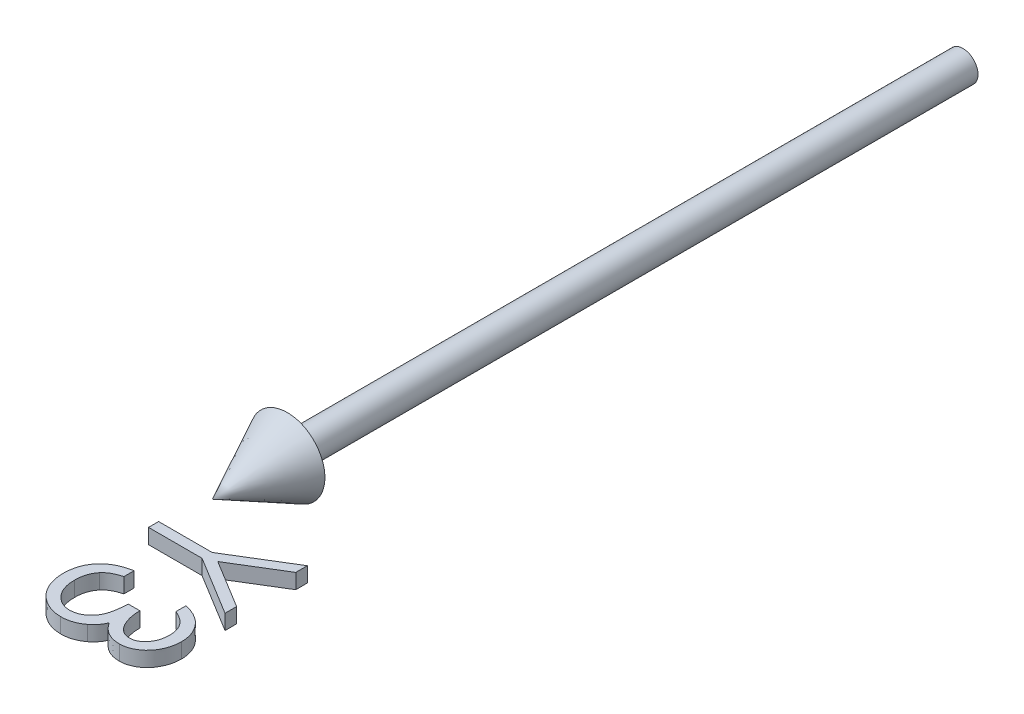
from build123d import *

# Parameters (mm, degrees)
BOSS_EXTRUDE1_DEPTH        = 1
BOSS_EXTRUDE1_DEPTH_BACK   = 1
BOSS_EXTRUDE1_2_DEPTH      = 1
BOSS_EXTRUDE1_2_DEPTH_BACK = 1


with BuildPart() as part:
    # Sketch2 → Revolve1 (revolve)
    with BuildSketch(Plane(origin=(0, 0, 0), x_dir=(1, 0, 0), z_dir=(0, 1, 0))):
        Polygon((0, -100), (5, -90), (2, -90), (2, 0), (0, 0), align=None)
    revolve(axis=Axis((0, 0, -41.949952025), (0, 0, 1)))


with BuildPart() as body_2:
    # Sketch3 → Boss-Extrude1 (new, two sides: drawn at the far end of the back side and taken through both)
    with BuildSketch(Plane(origin=(0, 0, 0), x_dir=(1, 0, 0), z_dir=(0, 1, 0)).offset(-BOSS_EXTRUDE1_DEPTH_BACK)):
        Polygon((15, -102.339799406), (15, -103.881265752), (8.5546875, -107.823573444), (15, -111.759871521), (15, -113.301337867), (7.130408654, -108.49364556), (0, -108.49364556), (0, -107.147491713), (7.130408654, -107.147491713), align=None)
    extrude(amount=BOSS_EXTRUDE1_DEPTH + BOSS_EXTRUDE1_DEPTH_BACK)


with BuildPart() as body_3:
    # Sketch3 → Boss-Extrude1 2 (new, two sides: drawn at the far end of the back side and taken through both)
    with BuildSketch(Plane(origin=(0, 0, 0), x_dir=(1, 0, 0), z_dir=(0, 1, 0)).offset(-BOSS_EXTRUDE1_2_DEPTH_BACK)):
        with BuildLine():
            Line((11.538461538, -116.378260944), (11.538461538, -115.032107098))
            add(Edge.make_bspline(
                [(11.538461538, -115.032107098), (11.689457898, -115.068576601), (11.984643431, -115.139871496), (12.406388835, -115.288575383), (12.805489641, -115.450572191), (13.174472814, -115.645096924), (13.520753826, -115.8572773), (13.836478645, -116.100374678), (14.129677068, -116.363173489), (14.389876658, -116.653851843), (14.625495497, -116.958688964), (14.8263886, -117.281980192), (14.999206398, -117.617221164), (15.141578821, -117.966734591), (15.248831065, -118.331561042), (15.326645946, -118.708402284), (15.377179293, -119.098245856), (15.382111134, -119.362878387), (15.384615385, -119.497251329)],
                knots=[0, 0, 0, 0, 1.162005537, 2.271625781, 3.343758855, 4.383309926, 5.390229558, 6.379919256, 7.361854164, 8.333198761, 9.295911338, 10.242430842, 11.177959212, 12.116337295, 13.062827104, 14.020064771, 14.994644689, 16, 16, 16, 16], degree=3))
            add(Edge.make_bspline(
                [(15.384615385, -119.497251329), (15.378704398, -119.693034509), (15.36701136, -120.08033027), (15.260235204, -120.649314757), (15.091270351, -121.198001125), (14.85781152, -121.720383616), (14.569865892, -122.205605469), (14.227159877, -122.637331984), (13.836305728, -123.009711316), (13.404594738, -123.322115792), (12.943213983, -123.566722931), (12.468356167, -123.747093103), (11.981147718, -123.856900307), (11.65218795, -123.871131265), (11.487379808, -123.878260944)],
                knots=[0, 0, 0, 0, 1.083050992, 2.142477498, 3.193116406, 4.255571735, 5.30263384, 6.308962982, 7.297363603, 8.282367274, 9.249857812, 10.179914175, 11.08814088, 12, 12, 12, 12], degree=3))
            add(Edge.make_bspline(
                [(11.487379808, -123.878260944), (11.328779259, -123.873274125), (11.018422597, -123.863515695), (10.565330466, -123.780656957), (10.138295037, -123.64121583), (9.735518627, -123.448059705), (9.359555028, -123.19802449), (9.009558353, -122.895141503), (8.683976247, -122.537272952), (8.49746422, -122.266077504), (8.401442308, -122.12645806)],
                knots=[0, 0, 0, 0, 1.024540389, 2.004866551, 2.965041327, 3.920577974, 4.882998113, 5.874504559, 6.905732034, 8, 8, 8, 8], degree=3))
            add(Edge.make_bspline(
                [(8.401442308, -122.12645806), (8.324393001, -122.286022722), (8.17173604, -122.602166469), (7.872354222, -123.03309731), (7.526684162, -123.424288204), (7.256929935, -123.642447), (7.121394231, -123.752059021)],
                knots=[0, 0, 0, 0, 1.015518401, 2.012035669, 3.001164323, 4, 4, 4, 4], degree=3))
            add(Edge.make_bspline(
                [(7.121394231, -123.752059021), (7.022585827, -123.824265583), (6.826587074, -123.967496274), (6.511277108, -124.143790761), (6.193516116, -124.305552835), (5.860810145, -124.424605039), (5.523846298, -124.527342374), (5.175408835, -124.594940119), (4.818808204, -124.638335167), (4.577450896, -124.644428718), (4.456129808, -124.647491713)],
                knots=[0, 0, 0, 0, 1.02516404, 2.033540309, 3.025129118, 4.011046665, 4.991655828, 5.976607087, 6.982917762, 8, 8, 8, 8], degree=3))
            add(Edge.make_bspline(
                [(4.456129808, -124.647491713), (4.246096498, -124.639784006), (3.827018298, -124.624404865), (3.207715637, -124.487498568), (2.603383897, -124.274032525), (2.022977307, -123.976193088), (1.481063404, -123.607687464), (0.998397563, -123.166846008), (0.580716501, -122.664385507), (0.232859438, -122.103594463), (-0.045411202, -121.496288672), (-0.238500659, -120.846664481), (-0.364273007, -120.164168202), (-0.377759067, -119.696136382), (-0.384615385, -119.458188829)],
                knots=[0, 0, 0, 0, 0.95570045, 1.906903359, 2.87519758, 3.868912786, 4.869932978, 5.851730567, 6.836639976, 7.83677598, 8.849487602, 9.869908895, 10.917060885, 12, 12, 12, 12], degree=3))
            add(Edge.make_bspline(
                [(-0.384615385, -119.458188829), (-0.380894471, -119.297820399), (-0.373572953, -118.982268806), (-0.323521805, -118.518368099), (-0.232107497, -118.075560816), (-0.109093331, -117.653248253), (0.046871278, -117.25105524), (0.24109427, -116.870209075), (0.469572136, -116.508366674), (0.735001798, -116.168942598), (1.031921825, -115.851977308), (1.365603296, -115.565894204), (1.729877885, -115.305923663), (2.128976697, -115.07902664), (2.557742085, -114.874868271), (3.021664221, -114.706949886), (3.516595744, -114.559154592), (3.861500345, -114.490439745), (4.038461538, -114.455184021)],
                knots=[0, 0, 0, 0, 1.048658725, 2.063410685, 3.046034179, 4.001477787, 4.936774919, 5.862367409, 6.792675028, 7.730719943, 8.675894397, 9.627829632, 10.600096036, 11.597688215, 12.626045268, 13.701542398, 14.82072376, 16, 16, 16, 16], degree=3))
            Line((4.038461538, -114.455184021), (4.038461538, -115.801337867))
            add(Edge.make_bspline(
                [(4.038461538, -115.801337867), (3.922965767, -115.836409116), (3.69831646, -115.904625742), (3.375000865, -116.020744162), (3.078609208, -116.153036757), (2.806967257, -116.294956294), (2.557399817, -116.444006777), (2.336506093, -116.610785027), (2.134583798, -116.782938507), (2.020821175, -116.912707164), (1.965144231, -116.976217675)],
                knots=[0, 0, 0, 0, 1.198163088, 2.33053128, 3.407730985, 4.417276592, 5.372219308, 6.28897303, 7.162600585, 8, 8, 8, 8], degree=3))
            add(Edge.make_bspline(
                [(1.965144231, -116.976217675), (1.900394228, -117.060203003), (1.771094092, -117.227914415), (1.606087113, -117.501206834), (1.46311129, -117.788627775), (1.353895451, -118.09640495), (1.261419762, -118.417896823), (1.200903251, -118.758299817), (1.159382517, -119.114610748), (1.155718525, -119.357901163), (1.153846154, -119.48222729)],
                knots=[0, 0, 0, 0, 0.946170439, 1.889420265, 2.845303464, 3.807233317, 4.801018734, 5.828864929, 6.890507805, 8, 8, 8, 8], degree=3))
            add(Edge.make_bspline(
                [(1.153846154, -119.48222729), (1.156481455, -119.622601345), (1.161634559, -119.89709069), (1.209161849, -120.297584969), (1.2780779, -120.67871174), (1.385876004, -121.036581606), (1.515197637, -121.376064298), (1.68450339, -121.689581581), (1.875706866, -121.986350475), (2.098113283, -122.257677025), (2.338510547, -122.502291177), (2.593550619, -122.71366483), (2.855325599, -122.896738589), (3.129942168, -123.043899339), (3.414706557, -123.160310399), (3.710684643, -123.239510353), (4.015384104, -123.294591939), (4.222508678, -123.299076924), (4.326923077, -123.301337867)],
                knots=[0, 0, 0, 0, 1.216990249, 2.379719373, 3.493992396, 4.571561497, 5.616923107, 6.638958652, 7.655775068, 8.674704564, 9.676001865, 10.625896028, 11.54399481, 12.441854662, 13.322657739, 14.20572845, 15.095482574, 16, 16, 16, 16], degree=3))
            add(Edge.make_bspline(
                [(4.326923077, -123.301337867), (4.466686116, -123.294779549), (4.745516752, -123.281695545), (5.155732562, -123.181799888), (5.550984985, -123.017497274), (5.924473647, -122.78744557), (6.270794327, -122.507537233), (6.578588517, -122.180481761), (6.835117225, -121.805476886), (7.011701967, -121.458108274), (7.129388272, -121.149678256), (7.211907706, -120.886254517), (7.277872279, -120.591082733), (7.341679886, -120.26770638), (7.395172135, -119.914761618), (7.439973989, -119.531930467), (7.475766198, -119.11905891), (7.491758771, -118.833240202), (7.5, -118.685953252)],
                knots=[0, 0, 0, 0, 1.070481957, 2.135637345, 3.216366529, 4.339485895, 5.485746587, 6.620975969, 7.768829582, 8.956804399, 9.598399438, 10.297751078, 11.070570279, 11.915248466, 12.824061284, 13.805856426, 14.869322739, 16, 16, 16, 16], degree=3))
            Line((7.5, -118.685953252), (9.038461538, -118.685953252))
            add(Edge.make_bspline(
                [(9.038461538, -118.685953252), (9.041624428, -118.871524547), (9.047819752, -119.235013129), (9.122232223, -119.766060923), (9.226325481, -120.27447642), (9.382087198, -120.74865446), (9.569045715, -121.179441641), (9.779855096, -121.555235995), (10.018692666, -121.867131342), (10.282423912, -122.115906925), (10.568581806, -122.298499369), (10.863711079, -122.435553084), (11.174678411, -122.515899524), (11.386778343, -122.52668555), (11.493389423, -122.532107098)],
                knots=[0, 0, 0, 0, 1.321708579, 2.588902423, 3.815526512, 5.016621128, 6.138757764, 7.158873101, 8.079948563, 8.928590313, 9.728601868, 10.489025425, 11.240515403, 12, 12, 12, 12], degree=3))
            add(Edge.make_bspline(
                [(11.493389423, -122.532107098), (11.571722805, -122.530331258), (11.727563353, -122.526798308), (11.955239455, -122.482235512), (12.17596811, -122.415286662), (12.388747781, -122.323187293), (12.592343397, -122.20013859), (12.78700473, -122.052439155), (12.975994101, -121.880017701), (13.150270028, -121.678367998), (13.314656854, -121.460060687), (13.456763151, -121.223041636), (13.577212353, -120.972538587), (13.676729071, -120.708321186), (13.751541535, -120.429330987), (13.805270227, -120.136934075), (13.838859158, -119.830557559), (13.843695367, -119.621535951), (13.846153846, -119.515280175)],
                knots=[0, 0, 0, 0, 0.884317272, 1.759307272, 2.611736065, 3.488921043, 4.37244062, 5.294096728, 6.247679003, 7.258495569, 8.302441962, 9.333537773, 10.376747089, 11.440883505, 12.520330301, 13.637364711, 14.798958396, 16, 16, 16, 16], degree=3))
            add(Edge.make_bspline(
                [(13.846153846, -119.515280175), (13.840202433, -119.344481668), (13.828577938, -119.01087246), (13.726403869, -118.530030024), (13.56451959, -118.083483333), (13.369044803, -117.743304832), (13.176749979, -117.491678785), (13.011318743, -117.308421765), (12.823753604, -117.131743225), (12.608909862, -116.968576193), (12.374175124, -116.809143353), (12.118256559, -116.654967051), (11.837505532, -116.510999434), (11.640073318, -116.423363987), (11.538461538, -116.378260944)],
                knots=[0, 0, 0, 0, 1.4727372, 2.876598283, 4.222346151, 5.558423782, 6.24313385, 6.953189256, 7.68715613, 8.463578749, 9.278833271, 10.135787152, 11.040551781, 12, 12, 12, 12], degree=3))
        make_face()
    extrude(amount=BOSS_EXTRUDE1_2_DEPTH + BOSS_EXTRUDE1_2_DEPTH_BACK)


solid = Compound([part.part, body_2.part, body_3.part])
